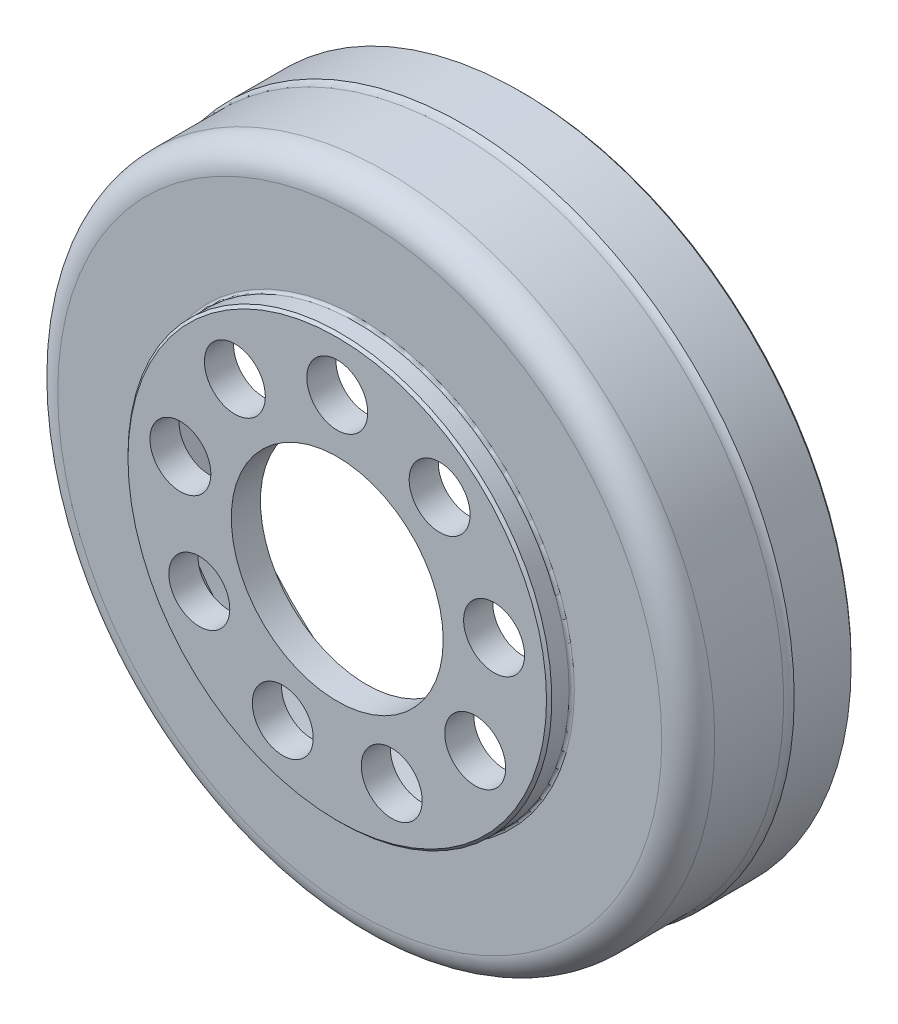
from build123d import *

# Parameters (mm, degrees)
SKETCH1_R           = 25
BOSS_EXTRUDE1_DEPTH = 4.5
SKETCH2_R           = 24.8
BOSS_EXTRUDE2_DEPTH = 7.8
FILLET1_R           = 2
FILLET2_R           = 1
SHELL1_T            = -0.5
CHAMFER1_SIZE       = 0.2
SKETCH3_R           = 16
BOSS_EXTRUDE3_DEPTH = 1.7
CHAMFER2_SIZE       = 0.2
FILLET3_R           = 0.2
SKETCH4_R           = 8
SKETCH4_R_2         = 2.3
CUT_EXTRUDE1_DEPTH  = 39.026306684


with BuildPart() as part:
    # Sketch1 → Boss-Extrude1 (new body)
    with BuildSketch(Plane.XY):
        Circle(SKETCH1_R)
    extrude(amount=BOSS_EXTRUDE1_DEPTH)

    # Sketch2 → Boss-Extrude2 (add)
    with BuildSketch(Plane.XY.offset(4.5)):
        Circle(SKETCH2_R)
    extrude(amount=BOSS_EXTRUDE2_DEPTH)

    # Fillet1
    fillet1_edges = [part.edges().sort_by_distance(p)[0] for p in [
        (-24.8, 0, 12.3),
    ]]
    fillet(fillet1_edges, radius=FILLET1_R)

    # Fillet2
    # the kernel refuses this fillet: 1 mm, written as the material it adds along each edge
    with BuildSketch(Plane(origin=(0, 0, 4.5), x_dir=(1, 0, 0), z_dir=(0, -1, 0))) as fillet2_piece_1:
        with BuildLine():
            CenterArc((25.8, 0.6), FILLET2_R, 180, 36.869897646)
            Line((25, 0), (24.984, -0.012))
            ThreePointArc((24.984, -0.012), (24.9, -0.02), (24.8, -0.02))
            Line((24.8, -0.02), (24.78, 0))
            Line((24.78, 0), (24.78, 0.6))
            Line((24.78, 0.6), (24.8, 0.6))
        make_face()
    revolve(axis=Axis((0, 0, 4.5), (0, 0, 1)))

    # Shell1
    shell1_openings = [part.faces().sort_by_distance(p)[0] for p in [
        (0, 0, 0),
    ]]
    offset(amount=SHELL1_T, openings=shell1_openings, kind=Kind.INTERSECTION)

    # Chamfer1
    chamfer1_edges = [part.edges().sort_by_distance(p)[0] for p in [
        (-25, 0, 0),
    ]]
    chamfer(chamfer1_edges, length=CHAMFER1_SIZE)

    # Sketch3 → Boss-Extrude3 (add)
    with BuildSketch(Plane.XY.offset(12.3)):
        Circle(SKETCH3_R)
    extrude(amount=BOSS_EXTRUDE3_DEPTH)

    # Chamfer2
    chamfer2_edges = [part.edges().sort_by_distance(p)[0] for p in [
        (-16, 0, 14),
    ]]
    chamfer(chamfer2_edges, length=CHAMFER2_SIZE)

    # Fillet3
    fillet3_edges = [part.edges().sort_by_distance(p)[0] for p in [
        (-16, 0, 12.3),
    ]]
    fillet(fillet3_edges, radius=FILLET3_R)

    # Sketch4 → Cut-Extrude1 (cut, through all)
    with BuildSketch(Plane.XY.offset(14)):
        Circle(SKETCH4_R)
        with Locations((0, 12.024661136)):
            Circle(SKETCH4_R_2)
        with Locations((7.729303189, 9.211424844)):
            Circle(SKETCH4_R_2)
        with Locations((11.841979514, 2.088060493)):
            Circle(SKETCH4_R_2)
        with Locations((10.413662016, -6.012330568)):
            Circle(SKETCH4_R_2)
        with Locations((4.112676325, -11.299485337)):
            Circle(SKETCH4_R_2)
        with Locations((-4.112676325, -11.299485337)):
            Circle(SKETCH4_R_2)
        with Locations((-10.413662016, -6.012330568)):
            Circle(SKETCH4_R_2)
        with Locations((-11.841979514, 2.088060493)):
            Circle(SKETCH4_R_2)
        with Locations((-7.729303189, 9.211424844)):
            Circle(SKETCH4_R_2)
    extrude(amount=-CUT_EXTRUDE1_DEPTH, mode=Mode.SUBTRACT)


solid = part.part
